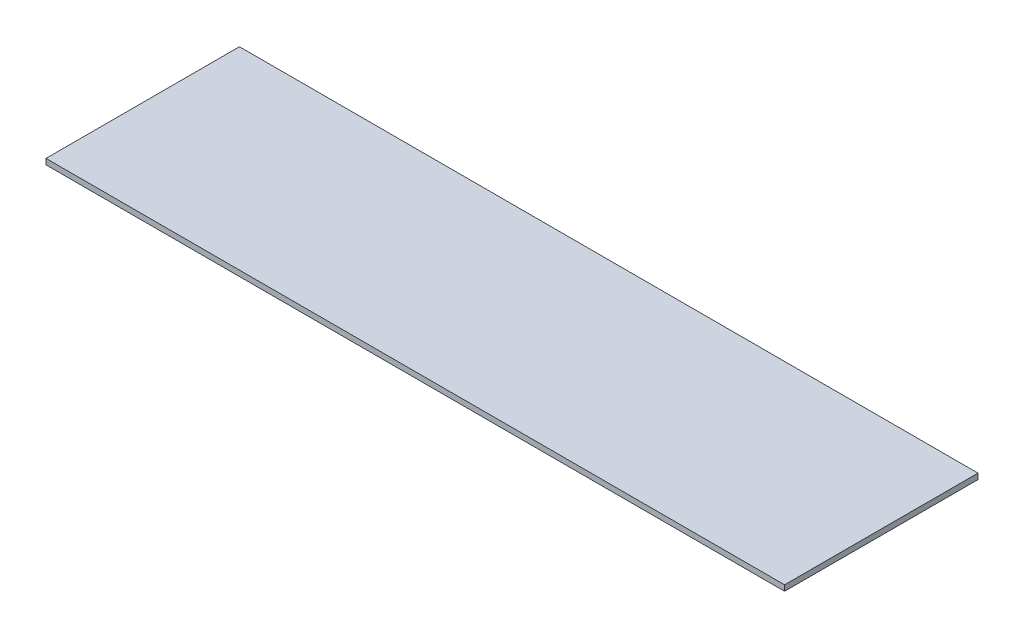
from build123d import *

# Parameters (mm, degrees)
SKIZZE1_W                       = 2100
SKIZZE1_H                       = 550
AUFSATZ_LINEAR_AUSTRAGEN1_DEPTH = 16


with BuildPart() as part:
    # Skizze1 → Aufsatz-Linear austragen1 (new body)
    with BuildSketch(Plane(origin=(0, 0, 0), x_dir=(1, 0, 0), z_dir=(0, 1, 0))):
        Rectangle(SKIZZE1_W, SKIZZE1_H)
    extrude(amount=AUFSATZ_LINEAR_AUSTRAGEN1_DEPTH)


solid = part.part
